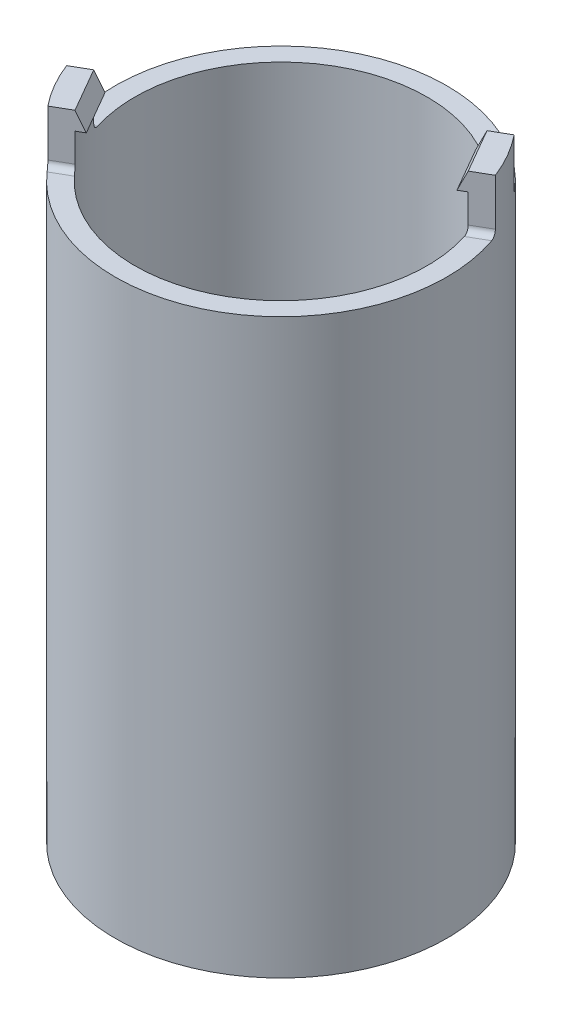
from build123d import *
from build123d.topology import SkipClean

# Parameters (mm, degrees)
SKETCH1_R                = 5.5
SKETCH1_R_2              = 4.85
BOSS_EXTRUDE1_DEPTH      = 17
BOSS_EXTRUDE2_START      = -1.75
BOSS_EXTRUDE2_DEPTH      = 1.75
BOSS_EXTRUDE3_DEPTH      = 1.7
BOSS_EXTRUDE3_2_DEPTH    = 1.7
BOSS_EXTRUDE4_REACH      = 128.36
BOSS_EXTRUDE4_END_RADIUS = 4.85
SKETCH3_W                = 1.7
SKETCH3_H                = 0.6
BOSS_EXTRUDE5_START      = -9.624935
SKETCH3_2_W              = 1.7
SKETCH3_2_H              = 0.6
BOSS_EXTRUDE5_DEPTH      = 0.075066
FILLET1_R                = 0.2
BOSS_EXTRUDE6_START      = 17
SKETCH1_4_R              = 5.5
SKETCH1_4_W              = 6
SKETCH1_4_H              = 6
BOSS_EXTRUDE6_DEPTH      = 2


with BuildPart() as part:
    # Sketch1 → Boss-Extrude1 (new body)
    with BuildSketch(Plane.XZ.offset(-123.994845224)):
        with Locations(Location((0, 0, 0), (0, 0, 270))):
            Circle(SKETCH1_R)
        with Locations(Location((0, 0, 0), (0, 0, 270))):
            Circle(SKETCH1_R_2, mode=Mode.SUBTRACT)
    extrude(amount=BOSS_EXTRUDE1_DEPTH)

    # Sketch1<3> → Boss-Extrude2 (add)
    with SkipClean():  # the faces are left unmerged after this step: merging them gives an invalid solid
        with BuildSketch(Plane.XZ.offset(-123.994845224).offset(BOSS_EXTRUDE2_START)):
            with BuildLine():
                ThreePointArc((4.280924301, -3.453069233), (4.763148058, -2.74998556), (5.130919838, -1.98082347))
                Line((5.130919838, -1.98082347), (5.108754465, -1.968026376))
                Line((5.108754465, -1.968026376), (4.625228328, -1.688864385))
                Line((4.625228328, -1.688864385), (4.20023564, -2.424978467))
                Line((4.20023564, -2.424978467), (3.775232792, -3.161110148))
                Line((3.775232792, -3.161110148), (4.258758928, -3.440272139))
                Line((4.258758928, -3.440272139), (4.280924301, -3.453069233))
            make_face()
            with BuildLine():
                Line((-3.775232792, 3.161110148), (-4.258758928, 3.440272139))
                Line((-4.258758928, 3.440272139), (-4.280924301, 3.453069233))
                ThreePointArc((-4.280924301, 3.453069233), (-4.763148058, 2.74998556), (-5.130919838, 1.98082347))
                Line((-5.130919838, 1.98082347), (-5.108754465, 1.968026376))
                Line((-5.108754465, 1.968026376), (-4.625228328, 1.688864385))
                Line((-4.625228328, 1.688864385), (-4.200235262, 2.424979122))
                Line((-4.200235262, 2.424979122), (-3.775232792, 3.161110148))
            make_face()
            with BuildLine():
                Line((4.625228328, -1.688864385), (4.560219632, -1.651331859))
                ThreePointArc((4.560219632, -1.651331859), (4.397274885, -2.046087385), (4.20023564, -2.424978467))
                Line((4.20023564, -2.424978467), (4.625228328, -1.688864385))
            make_face()
            with BuildLine():
                ThreePointArc((4.20023564, -2.424978467), (3.970623818, -2.785075672), (3.710224095, -3.123577623))
                Line((3.710224095, -3.123577623), (3.775232792, -3.161110148))
                Line((3.775232792, -3.161110148), (4.20023564, -2.424978467))
            make_face()
            with BuildLine():
                ThreePointArc((-4.560219632, 1.651331859), (-4.397274725, 2.046087728), (-4.200235262, 2.424979122))
                Line((-4.200235262, 2.424979122), (-4.625228328, 1.688864385))
                Line((-4.625228328, 1.688864385), (-4.560219632, 1.651331859))
            make_face()
            with BuildLine():
                Line((-3.710224095, 3.123577623), (-3.775232792, 3.161110148))
                Line((-3.775232792, 3.161110148), (-4.200235262, 2.424979122))
                ThreePointArc((-4.200235262, 2.424979122), (-3.970623601, 2.785075982), (-3.710224095, 3.123577623))
            make_face()
        extrude(amount=BOSS_EXTRUDE2_DEPTH)



with BuildPart() as body_2:
    # Sketch2 → Boss-Extrude3 (new body)
    with BuildSketch(Plane(origin=(0.424997768, 0, 0.736122882), x_dir=(0.866026919582721, 0, -0.49999737455117027), z_dir=(0.49999737455117027, 0, 0.866026919582721))):
        Polygon((4.5, 125.144845224), (4.774934555, 125.144845224), (4.774934555, 125.744845224), align=None)
    extrude(amount=-BOSS_EXTRUDE3_DEPTH)


with BuildPart() as body_3:
    # Sketch2 → Boss-Extrude3 2 (new body)
    with BuildSketch(Plane(origin=(0.424997768, 0, 0.736122882), x_dir=(0.866026919582721, 0, -0.49999737455117027), z_dir=(0.49999737455117027, 0, 0.866026919582721))):
        Polygon((-4.5, 125.144845224), (-4.774934555, 125.744845224), (-4.774934555, 125.144845224), align=None)
    extrude(amount=-BOSS_EXTRUDE3_2_DEPTH)


with BuildPart() as part_1:
    with SkipClean():  # the faces are left unmerged after this step: merging them gives an invalid solid
        add(part.part)

        add(body_2.part)  # Boss-Extrude4 merges body 2
        # Boss-Extrude4: up to this cylinder (the profile starts inside it)
        boss_extrude4_end = Plane(origin=(0, 125.444845, 0), z_dir=(0, 1, 0)) * Cylinder(BOSS_EXTRUDE4_END_RADIUS, 267.42, mode=Mode.PRIVATE)
        # Sketch3 → Boss-Extrude4 (add, up to the surface)
        with BuildSketch(Plane(origin=(4.135221863, 0, -2.387454741), x_dir=(-0.4999973745511703, 0, -0.866026919582721), z_dir=(0.866026919582721, 0, -0.4999973745511703)), mode=Mode.PRIVATE) as boss_extrude4_sk1:
            with Locations((0, 125.444845224)):
                Rectangle(SKETCH3_W, SKETCH3_H)
        boss_extrude4_tool1 = extrude(boss_extrude4_sk1.sketch, amount=BOSS_EXTRUDE4_REACH, mode=Mode.PRIVATE) & boss_extrude4_end
        add(boss_extrude4_tool1.solids().sort_by_distance((4.135222, 125.444845, -2.387455))[0])


    with SkipClean():  # the faces are left unmerged after this step: merging them gives an invalid solid
        add(body_3.part)  # Boss-Extrude5 merges body 3
        # Sketch3<2> → Boss-Extrude5 (add)
        with BuildSketch(Plane(origin=(4.135221863, 0, -2.387454741), x_dir=(-0.4999973745511703, 0, -0.866026919582721), z_dir=(0.866026919582721, 0, -0.4999973745511703)).offset(BOSS_EXTRUDE5_START)):
            with Locations((0, 125.444845224)):
                Rectangle(SKETCH3_2_W, SKETCH3_2_H)
        extrude(amount=BOSS_EXTRUDE5_DEPTH)

    # Fillet1
    # the kernel refuses this fillet: 0.2 mm, written as the material it adds along each edge
    with BuildSketch(Plane(origin=(-4.713937761, 123.994845224, 3.70306792), x_dir=(0.49999737455195337, 0, 0.866026919582269), z_dir=(0.866026919582269, 0, -0.4999973745519534))) as fillet1_piece_1_section:
        with BuildLine():
            CenterArc((FILLET1_R, -FILLET1_R), FILLET1_R, 90, 90)
            Line((0, -FILLET1_R), (0, 0))
            Line((0, 0), (FILLET1_R, 0))
        make_face()
    fillet1_piece_1 = extrude(amount=1.083921236, mode=Mode.PRIVATE)
    fillet1_piece_1 = fillet1_piece_1 & Plane(origin=(0, 124.040443489, 0), x_dir=(0, 0, -1), z_dir=(0, 1, 0)) * Cylinder(5.5, 3, mode=Mode.PRIVATE)
    add(fillet1_piece_1)
    with BuildSketch(Plane(origin=(4.713937761, 123.994845224, -3.70306792), x_dir=(-0.49999737455261106, 0, -0.8660269195818893), z_dir=(-0.8660269195818893, 0, 0.4999973745526111))) as fillet1_piece_2_section:
        with BuildLine():
            CenterArc((FILLET1_R, -FILLET1_R), FILLET1_R, 90, 90)
            Line((0, -FILLET1_R), (0, 0))
            Line((0, 0), (FILLET1_R, 0))
        make_face()
    fillet1_piece_2 = extrude(amount=1.083921236, mode=Mode.PRIVATE)
    fillet1_piece_2 = fillet1_piece_2 & Plane(origin=(0, 124.040443489, 0), x_dir=(0, 0, -1), z_dir=(0, 1, 0)) * Cylinder(5.5, 3, mode=Mode.PRIVATE)
    add(fillet1_piece_2)
    with BuildSketch(Plane(origin=(-4.625228328, 123.994845224, 1.688864385), x_dir=(-0.49999737454985904, 0, -0.866026919583478), z_dir=(-0.8660269195834781, 0, 0.49999737454985904))) as fillet1_piece_3_section:
        with BuildLine():
            CenterArc((FILLET1_R, -FILLET1_R), FILLET1_R, 90, 90)
            Line((0, -FILLET1_R), (0, 0))
            Line((0, 0), (FILLET1_R, 0))
        make_face()
    fillet1_piece_3 = extrude(amount=1.083921236, mode=Mode.PRIVATE)
    fillet1_piece_3 = fillet1_piece_3 & Plane(origin=(0, 124.040443489, 0), x_dir=(0, 0, -1), z_dir=(0, 1, 0)) * Cylinder(5.5, 3, mode=Mode.PRIVATE)
    add(fillet1_piece_3)
    with BuildSketch(Plane(origin=(4.625228328, 123.994845224, -1.688864385), x_dir=(0.4999973745501742, 0, 0.866026919583296), z_dir=(0.8660269195832961, 0, -0.49999737455017423))) as fillet1_piece_4_section:
        with BuildLine():
            CenterArc((FILLET1_R, -FILLET1_R), FILLET1_R, 90, 90)
            Line((0, -FILLET1_R), (0, 0))
            Line((0, 0), (FILLET1_R, 0))
        make_face()
    fillet1_piece_4 = extrude(amount=1.083921236, mode=Mode.PRIVATE)
    fillet1_piece_4 = fillet1_piece_4 & Plane(origin=(0, 124.040443489, 0), x_dir=(0, 0, -1), z_dir=(0, 1, 0)) * Cylinder(5.5, 3, mode=Mode.PRIVATE)
    add(fillet1_piece_4)
    with BuildSketch(Plane(origin=(4.625228328, 123.994845224, -1.688864385), x_dir=(0.4999973745511805, 0, 0.8660269195827152), z_dir=(-0.8660269195827152, 0, 0.49999737455118054))) as fillet1_piece_5_section:
        with BuildLine():
            CenterArc((FILLET1_R, FILLET1_R), FILLET1_R, 180, 90)
            Line((0, FILLET1_R), (0, 0))
            Line((0, 0), (FILLET1_R, 0))
        make_face()
    fillet1_piece_5 = extrude(amount=0.575065445, mode=Mode.PRIVATE)
    fillet1_piece_5 = fillet1_piece_5 - Plane(origin=(0, 124.037616214, 0), x_dir=(0, 0, -1), z_dir=(0, 1, 0)) * Cylinder(4.85, 2, mode=Mode.PRIVATE)
    add(fillet1_piece_5)
    with BuildSketch(Plane(origin=(-4.625228328, 123.994845224, 1.688864385), x_dir=(-0.49999737455107873, 0, -0.8660269195827739), z_dir=(0.8660269195827739, 0, -0.49999737455107884))) as fillet1_piece_6_section:
        with BuildLine():
            CenterArc((FILLET1_R, FILLET1_R), FILLET1_R, 180, 90)
            Line((0, FILLET1_R), (0, 0))
            Line((0, 0), (FILLET1_R, 0))
        make_face()
    fillet1_piece_6 = extrude(amount=0.575065445, mode=Mode.PRIVATE)
    fillet1_piece_6 = fillet1_piece_6 - Plane(origin=(0, 124.037616214, 0), x_dir=(0, 0, -1), z_dir=(0, 1, 0)) * Cylinder(4.85, 2, mode=Mode.PRIVATE)
    add(fillet1_piece_6)
    with BuildSketch(Plane(origin=(3.277210635, 123.994845224, -2.873578935), x_dir=(-0.49999737455115034, 0, -0.8660269195827325), z_dir=(0.8660269195827326, 0, -0.49999737455115034))) as fillet1_piece_7_section:
        with BuildLine():
            CenterArc((FILLET1_R, FILLET1_R), FILLET1_R, 180, 90)
            Line((0, FILLET1_R), (0, 0))
            Line((0, 0), (FILLET1_R, 0))
        make_face()
    fillet1_piece_7 = extrude(amount=0.575065445, mode=Mode.PRIVATE)
    fillet1_piece_7 = fillet1_piece_7 - Plane(origin=(0, 124.037616214, 0), x_dir=(0, 0, -1), z_dir=(0, 1, 0)) * Cylinder(4.85, 2, mode=Mode.PRIVATE)
    add(fillet1_piece_7)
    with BuildSketch(Plane(origin=(-3.277210635, 123.994845224, 2.873578935), x_dir=(0.4999973745510395, 0, 0.8660269195827964), z_dir=(-0.8660269195827965, 0, 0.49999737455103954))) as fillet1_piece_8_section:
        with BuildLine():
            CenterArc((FILLET1_R, FILLET1_R), FILLET1_R, 180, 90)
            Line((0, FILLET1_R), (0, 0))
            Line((0, 0), (FILLET1_R, 0))
        make_face()
    fillet1_piece_8 = extrude(amount=0.575065445, mode=Mode.PRIVATE)
    fillet1_piece_8 = fillet1_piece_8 - Plane(origin=(0, 124.037616214, 0), x_dir=(0, 0, -1), z_dir=(0, 1, 0)) * Cylinder(4.85, 2, mode=Mode.PRIVATE)
    add(fillet1_piece_8)

    # Sketch1<4> → Boss-Extrude6 (add)
    with BuildSketch(Plane.XZ.offset(-123.994845224).offset(BOSS_EXTRUDE6_START)):
        with Locations(Location((0, 0, 0), (0, 0, 161.006016149))):
            Circle(SKETCH1_4_R)
        Rectangle(SKETCH1_4_W, SKETCH1_4_H, mode=Mode.SUBTRACT)
    extrude(amount=BOSS_EXTRUDE6_DEPTH)


solid = part_1.part
